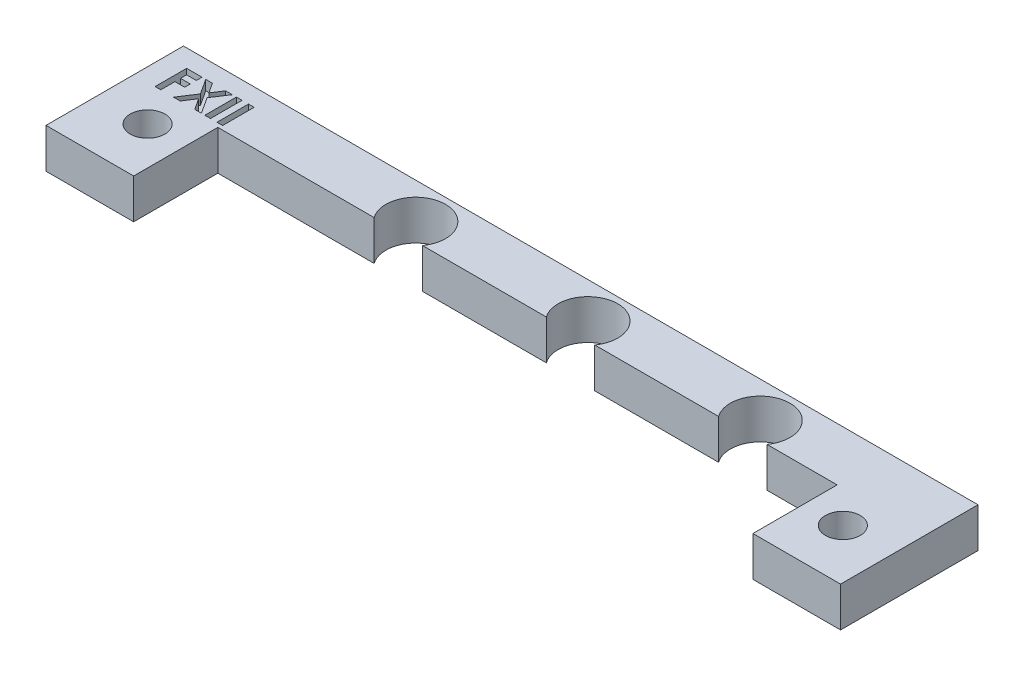
from build123d import *

# Parameters (mm, degrees)
BOSS_EXTRUDE1_OUTLINE_R = 1.75
BOSS_EXTRUDE1_DEPTH     = 4
SKETCH2_W               = 0.569871794
SKETCH2_H               = 3.175
SKETCH2_W_2             = 0.569871795
CUT_EXTRUDE1_DEPTH      = 1


# Read off the part's stored shape, not the designer's step: Boss-Extrude1
with BuildPart() as part:
    # Boss-Extrude1 outline → Boss-Extrude1 (new body)
    with BuildSketch(Plane(origin=(0, 0, 0), x_dir=(1, 0, 0), z_dir=(0, 1, 0))):
        with BuildLine():
            Line((25.076474615, -10.33744254), (37.54307775, -10.33744254))
            ThreePointArc((37.54307775, -10.33744254), (39.979776182, -5.587442326), (42.416474615, -10.33744254))
            Line((42.416474615, -10.33744254), (49.479776182, -10.33744254))
            Line((49.479776182, -10.33744254), (49.479776182, -18.81631662))
            Line((49.479776182, -18.81631662), (58.304776182, -18.81631662))
            Line((58.304776182, -18.81631662), (58.304776182, -4.977921711))
            Line((58.304776182, -4.977921711), (-21.695223818, -4.977921711))
            Line((-21.695223818, -4.977921711), (-21.695223818, -18.81631662))
            Line((-21.695223818, -18.81631662), (-12.870223818, -18.81631662))
            Line((-12.870223818, -18.81631662), (-12.870223818, -10.33744254))
            Line((-12.870223818, -10.33744254), (2.86307775, -10.33744254))
            ThreePointArc((2.86307775, -10.33744254), (5.299776182, -5.587442326), (7.736474615, -10.33744254))
            Line((7.736474615, -10.33744254), (20.20307775, -10.33744254))
            ThreePointArc((20.20307775, -10.33744254), (22.639776183, -5.587442326), (25.076474615, -10.33744254))
        make_face()
        with Locations((-16.695223818, -13.587442433)):
            Circle(BOSS_EXTRUDE1_OUTLINE_R, mode=Mode.SUBTRACT)
        with Locations((53.304776182, -13.587442433)):
            Circle(BOSS_EXTRUDE1_OUTLINE_R, mode=Mode.SUBTRACT)
    extrude(amount=BOSS_EXTRUDE1_DEPTH)

    # Sketch2 → Cut-Extrude1 (cut)
    with BuildSketch(Plane(origin=(0, 4, 0), x_dir=(1, 0, 0), z_dir=(0, 1, 0))):
        Polygon((-19.588408787, -6.762736227), (-18.041613915, -6.762736227), (-18.041613915, -7.332608022), (-19.018536992, -7.332608022), (-19.018536992, -7.943184945), (-18.041613915, -7.943184945), (-18.041613915, -8.51305674), (-19.018536992, -8.51305674), (-19.018536992, -9.937736227), (-19.588408787, -9.937736227), align=None)
        Polygon((-17.665727497, -6.762736227), (-16.994092881, -6.762736227), (-16.330726495, -7.782272485), (-15.666088073, -6.762736227), (-14.992545405, -6.762736227), (-15.99427317, -8.298718799), (-14.927671607, -9.937736227), (-15.599306223, -9.937736227), (-16.330726495, -8.813893078), (-17.063418803, -9.937736227), (-17.736325453, -9.937736227), (-16.666543803, -8.297446764), align=None)
        with Locations((-14.29674212, -8.350236227)):
            Rectangle(SKETCH2_W, SKETCH2_H)
        with Locations((-13.075588274, -8.350236227)):
            Rectangle(SKETCH2_W_2, SKETCH2_H)
    extrude(amount=-CUT_EXTRUDE1_DEPTH, mode=Mode.SUBTRACT)


solid = part.part
